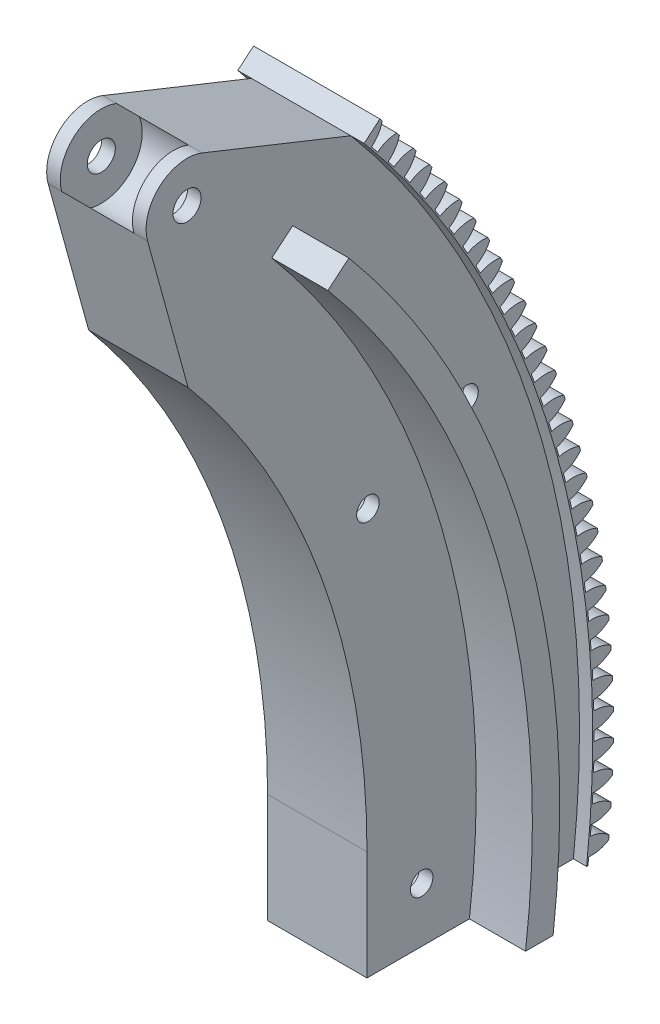
from build123d import *

# Parameters (mm, degrees)
TEETH_BLANK_DEPTH                                  = 6.35
PRIMARY_BLANK_DEPTH                                = 29.464
TOOTH_CUT_DEPTH                                    = 6.35
TOOTH_PATTERN_COUNT                                = 230
HOLES_FOR_TOP_SUPPORT_DEPTH                        = 284.05774535
HOLES_FOR_TOP_SUPPORT_DEPTH_BACK                   = 284.05774535
SKETCH15_R                                         = 3.2639
THING_TO_SLIDE_ALONG_BEARINGS_DEPTH                = 9.87425
EXTENDING_START                                    = 23.01875
EXTENDING_TEETH_DEPTH                              = 23.01875
SKETCH28_R                                         = 9.525
CUT_FOR_SPACE_FOR_TOP_SUPPORT_SCREWS_DEPTH         = 16.764
SKETCH29_R                                         = 3.429
MAGNET_HOLE_DEPTH                                  = 12.7
CUT_START                                          = -3.175
CUT_TO_MAKE_SPACE_FOR_ALUMINUM_REINFORCE_DEPTH     = 3.175
EMBEDDED_NUT_CAVITIES_DEPTH                        = 3.302
HOLES_FOR_BOLTS_FOR_REINFORCEMENT_PLATE_DEPTH      = 285.034601492
HOLES_FOR_BOLTS_FOR_REINFORCEMENT_PLATE_DEPTH_BACK = 285.034601492
SKETCH34_R                                         = 2.6289


with BuildPart() as part:
    # Sketch11 → Teeth blank (new body)
    with BuildSketch(Plane(origin=(6.35, 0, 0), x_dir=(0, 0, -1), z_dir=(1, 0, 0))):
        with BuildLine():
            Line((177.722316491, 149.126730219), (155.660230842, 130.614442288))
            ThreePointArc((155.660230842, 130.614442288), (190.945540544, 69.498493124), (203.2, 0))
            ThreePointArc((203.2, 0), (202.801171077, -12.724975829), (201.606249903, -25.4))
            Line((201.606249903, -25.4), (230.605384683, -25.4))
            ThreePointArc((230.605384683, -25.4), (231.65108936, -12.719129025), (232.000007424, 0))
            ThreePointArc((232.000007424, 0), (218.008694999, 79.348675791), (177.722316491, 149.126730219))
        make_face()
    extrude(amount=-TEETH_BLANK_DEPTH)

    # Sketch1 → Primary blank (add)
    with BuildSketch(Plane(origin=(0, 0, 0), x_dir=(0, 0, -1), z_dir=(1, 0, 0))):
        with BuildLine():
            Line((177.8, 0), (177.8, -25.4))
            Line((177.8, -25.4), (225.775729431, -25.4))
            ThreePointArc((225.775729431, -25.4), (226.843652905, -12.71995034), (227.2, 0))
            ThreePointArc((227.2, 0), (213.498163443, 77.706976564), (174.045297477, 146.041344921))
            Line((174.045297477, 146.041344921), (139.503343029, 159.851365822))
            ThreePointArc((139.503343029, 159.851365822), (129.618020291, 158.107153482), (126.784391338, 148.47738561))
            Line((126.784391338, 148.47738561), (136.202701987, 114.287637002))
            ThreePointArc((136.202701987, 114.287637002), (167.077347976, 60.811181483), (177.8, 0))
        make_face()
    extrude(amount=PRIMARY_BLANK_DEPTH)

    # Sketch12 → Tooth cut (cut)
    with BuildSketch(Plane(origin=(6.35, 0, 0), x_dir=(0, 0, -1), z_dir=(1, 0, 0))):
        with BuildLine():
            ThreePointArc((227.497230324, 1.124058456), (230.494867292, 1.773780404), (232.972473, 3.581938572))
            ThreePointArc((232.972473, 3.581938572), (233.000007424, 0), (232.972473, -3.581938572))
            ThreePointArc((232.972473, -3.581938572), (230.494867292, -1.773780404), (227.497230324, -1.124058456))
            ThreePointArc((227.497230324, -1.124058456), (227.50000728, 0), (227.497230324, 1.124058456))
        make_face()
    tooth_cut = extrude(amount=-TOOTH_CUT_DEPTH, mode=Mode.SUBTRACT)

    # Tooth pattern: Tooth cut ×230 about axis
    tooth_pattern_axis = Axis((0, 0, 0), (1, 0, 0))
    for i in range(1, TOOTH_PATTERN_COUNT):
        add(tooth_cut.rotate(tooth_pattern_axis, i * 360 / TOOTH_PATTERN_COUNT), mode=Mode.SUBTRACT)

    # Sketch15 → Holes for top support (cut, two sides: drawn at the far end of the back side and taken through both)
    with BuildSketch(Plane(origin=(6.35, 0, 0), x_dir=(0, 0, -1), z_dir=(1, 0, 0)).offset(-HOLES_FOR_TOP_SUPPORT_DEPTH_BACK)):
        with Locations((135.967339212, 151.007028537)):
            Circle(SKETCH15_R)
    extrude(amount=HOLES_FOR_TOP_SUPPORT_DEPTH + HOLES_FOR_TOP_SUPPORT_DEPTH_BACK, mode=Mode.SUBTRACT)

    # Sketch23 → Thing to slide along bearings (add)
    with BuildSketch(Plane(origin=(0, 0, 0), x_dir=(0, 0, -1), z_dir=(1, 0, 0))):
        with BuildLine():
            Line((155.660230842, 130.614442288), (160.524613056, 134.69614361))
            ThreePointArc((160.524613056, 134.69614361), (196.912588686, 71.670321034), (209.55, 0))
            ThreePointArc((209.55, 0), (209.163370775, -12.723475387), (208.004909798, -25.4))
            Line((208.004909798, -25.4), (201.606249903, -25.4))
            ThreePointArc((201.606249903, -25.4), (202.801171077, -12.724975829), (203.2, 0))
            ThreePointArc((203.2, 0), (190.945540544, 69.498493124), (155.660230842, 130.614442288))
        make_face()
    thing_to_slide_along_bearings = extrude(amount=-THING_TO_SLIDE_ALONG_BEARINGS_DEPTH)

    # Mirroring slider: Thing to slide along bearings across plane
    add(thing_to_slide_along_bearings.mirror(Plane(origin=(14.732, 0, 0), x_dir=(0, 0, 1), z_dir=(1, 0, 0))))

    # Sketch27 → Extending teeth (add)
    with BuildSketch(Plane(origin=(6.35, 0, 0), x_dir=(0, 0, -1), z_dir=(1, 0, 0)).offset(EXTENDING_START)):
        with BuildLine():
            Line((177.722316491, 149.126730219), (174.045297477, 146.041344921))
            ThreePointArc((174.045297477, 146.041344921), (217.513785946, 65.632255207), (225.775729431, -25.4))
            Line((225.775729431, -25.4), (226.07762674, -25.4))
            ThreePointArc((226.07762674, -25.4), (226.171897735, -24.546404775), (226.262945845, -23.692459772))
            ThreePointArc((226.262945845, -23.692459772), (228.663101283, -23.551544215), (230.891757831, -22.649494707))
            ThreePointArc((230.891757831, -22.649494707), (230.94034564, -22.148593645), (230.987846786, -21.647588364))
            ThreePointArc((230.987846786, -21.647588364), (228.971262049, -20.338394215), (226.641640358, -19.743864063))
            ThreePointArc((226.641640358, -19.743864063), (226.736426656, -18.623805724), (226.825677683, -17.503292725))
            ThreePointArc((226.825677683, -17.503292725), (229.221088498, -17.296869983), (231.424274191, -16.33428174))
            ThreePointArc((231.424274191, -16.33428174), (231.459161859, -15.832240407), (231.492960423, -15.330124577))
            ThreePointArc((231.492960423, -15.330124577), (229.441367736, -14.07650152), (227.096375799, -13.545826347))
            ThreePointArc((227.096375799, -13.545826347), (227.160532561, -12.423596854), (227.219143699, -11.301064066))
            ThreePointArc((227.219143699, -11.301064066), (229.608022346, -11.029288179), (231.784093084, -10.006879521))
            ThreePointArc((231.784093084, -10.006879521), (231.805254577, -9.504072559), (231.825325337, -9.001220877))
            ThreePointArc((231.825325337, -9.001220877), (229.740255675, -7.804104412), (227.381643413, -7.337680228))
            ThreePointArc((227.381643413, -7.337680228), (227.415122764, -6.21411703), (227.443050275, -5.090402129))
            ThreePointArc((227.443050275, -5.090402129), (229.823614083, -4.753475906), (231.970946001, -3.672009792))
            ThreePointArc((231.970946001, -3.672009792), (231.978365527, -3.168812415), (231.984693505, -2.665600128))
            ThreePointArc((231.984693505, -2.665600128), (229.867702826, -1.525883589), (227.497230324, -1.124058456))
            ThreePointArc((227.497230324, -1.124058456), (227.50000728, 0), (227.497230324, 1.124058456))
            ThreePointArc((227.497230324, 1.124058456), (229.867702826, 1.525883589), (231.984693505, 2.665600128))
            ThreePointArc((231.984693505, 2.665600128), (231.978365527, 3.168812415), (231.970946001, 3.672009792))
            ThreePointArc((231.970946001, 3.672009792), (229.823614083, 4.753475906), (227.443050275, 5.090402129))
            ThreePointArc((227.443050275, 5.090402129), (227.415122764, 6.21411703), (227.381643413, 7.337680228))
            ThreePointArc((227.381643413, 7.337680228), (229.740255675, 7.804104412), (231.825325337, 9.001220877))
            ThreePointArc((231.825325337, 9.001220877), (231.805254577, 9.504072559), (231.784093084, 10.006879521))
            ThreePointArc((231.784093084, 10.006879521), (229.608022346, 11.029288179), (227.219143699, 11.301064066))
            ThreePointArc((227.219143699, 11.301064066), (227.160532561, 12.423596854), (227.096375799, 13.545826347))
            ThreePointArc((227.096375799, 13.545826347), (229.441367736, 14.07650152), (231.492960423, 15.330124577))
            ThreePointArc((231.492960423, 15.330124577), (231.459161859, 15.832240407), (231.424274191, 16.33428174))
            ThreePointArc((231.424274191, 16.33428174), (229.221088498, 17.296869983), (226.825677683, 17.503292725))
            ThreePointArc((226.825677683, 17.503292725), (226.736426656, 18.623805724), (226.641640358, 19.743864063))
            ThreePointArc((226.641640358, 19.743864063), (228.971262049, 20.338394215), (230.987846786, 21.647588364))
            ThreePointArc((230.987846786, 21.647588364), (230.94034564, 22.148593645), (230.891757831, 22.649494707))
            ThreePointArc((230.891757831, 22.649494707), (228.663101283, 23.551544215), (226.262945845, 23.692459772))
            ThreePointArc((226.262945845, 23.692459772), (226.143121532, 24.810116812), (226.017776432, 25.927168167))
            ThreePointArc((226.017776432, 25.927168167), (228.330289425, 26.585109638), (230.310361361, 27.94889791))
            ThreePointArc((230.310361361, 27.94889791), (230.24919308, 28.448418771), (230.186941388, 28.947805772))
            ThreePointArc((230.186941388, 28.947805772), (227.934477093, 29.788643403), (225.531368117, 29.863946617))
            ThreePointArc((225.531368117, 29.863946617), (225.381059935, 30.977913661), (225.225249571, 32.091124447))
            ThreePointArc((225.225249571, 32.091124447), (227.518928183, 32.811986256), (229.461009714, 34.22935094))
            ThreePointArc((229.461009714, 34.22935094), (229.386219944, 34.727014622), (229.310350824, 35.2245149))
            ThreePointArc((229.310350824, 35.2245149), (227.035759654, 36.003513188), (224.631490431, 36.013147865))
            ThreePointArc((224.631490431, 36.013147865), (224.450810546, 37.12259363), (224.264651187, 38.231133128))
            ThreePointArc((224.264651187, 38.231133128), (226.537783789, 39.01437734), (228.440425662, 40.484260746))
            ThreePointArc((228.440425662, 40.484260746), (228.352070214, 40.979695873), (228.262640281, 41.474938174))
            ThreePointArc((228.262640281, 41.474938174), (225.967619622, 42.191515802), (223.563984308, 42.135474753))
            ThreePointArc((223.563984308, 42.135474753), (223.353067549, 43.239571328), (223.136698117, 44.342612304))
            ThreePointArc((223.136698117, 44.342612304), (225.387588412, 45.187654434), (227.249370803, 46.70895968))
            ThreePointArc((227.249370803, 46.70895968), (227.147515611, 47.201796539), (227.044591603, 47.694411295))
            ThreePointArc((227.044591603, 47.694411295), (224.730854085, 48.348033526), (222.329646362, 48.226358571))
            ThreePointArc((222.329646362, 48.226358571), (222.088650124, 49.324282038), (221.84223208, 50.421001361))
            ThreePointArc((221.84223208, 50.421001361), (224.06920037, 51.327210806), (225.888733947, 52.898802637))
            ThreePointArc((225.888733947, 52.898802637), (225.773455019, 53.388673455), (225.657113741, 53.878293059))
            ThreePointArc((225.657113741, 53.878293059), (223.326385962, 54.468472135), (220.929397701, 54.281254073))
            ThreePointArc((220.929397701, 54.281254073), (220.658501825, 55.37218512), (220.382219056, 56.461764377))
            ThreePointArc((220.382219056, 56.461764377), (222.583603493, 57.428464891), (224.359530453, 59.049170525))
            ThreePointArc((224.359530453, 59.049170525), (224.230913815, 59.535709743), (224.101242084, 60.021968822))
            ThreePointArc((224.101242084, 60.021968822), (221.75526332, 60.54826433), (219.364283245, 60.295642869))
            ThreePointArc((219.364283245, 60.295642869), (219.063689882, 61.378767402), (218.75774856, 62.460393508))
            ThreePointArc((218.75774856, 62.460393508), (220.931906389, 63.486863702), (222.662901469, 65.15547371))
            ThreePointArc((222.662901469, 65.15547371), (222.521043099, 65.638318252), (222.378137682, 66.120853942))
            ThreePointArc((222.378137682, 66.120853942), (220.01865859, 66.58287314), (217.635470939, 66.265036796))
            ThreePointArc((217.635470939, 66.265036796), (217.305404404, 67.339546548), (216.970032835, 68.412412353))
            ThreePointArc((216.970032835, 68.412412353), (219.115341617, 69.497886237), (220.800113083, 71.213155438))
            ThreePointArc((220.800113083, 71.213155438), (220.645118841, 71.691944989), (220.489086379, 72.170397203))
            ThreePointArc((220.489086379, 72.170397203), (218.117867692, 72.567795315), (215.744250889, 72.18498127))
            ThreePointArc((215.744250889, 72.18498127), (215.384957489, 73.250074401), (215.02040594, 74.313379293))
            ThreePointArc((215.02040594, 74.313379293), (217.135264766, 75.457046844), (218.772555378, 77.21769524))
            ThreePointArc((218.772555378, 77.21769524), (218.604540927, 77.69207251), (218.435497858, 78.166084208))
            ThreePointArc((218.435497858, 78.166084208), (216.054309067, 78.498564682), (213.692034393, 78.051058605))
            ThreePointArc((213.692034393, 78.051058605), (213.303782248, 79.105940303), (212.91032276, 80.158890803))
            ThreePointArc((212.91032276, 80.158890803), (214.993153443, 81.359898575), (216.581741393, 83.164612305))
            ThreePointArc((216.581741393, 83.164612305), (216.400832112, 83.634223294), (216.218904581, 84.103440753))
            ThreePointArc((216.218904581, 84.103440753), (213.829522619, 84.370755478), (211.480352893, 83.858891315))
            ThreePointArc((211.480352893, 83.858891315), (211.06343173, 84.902774388), (210.641357917, 85.944584746))
            ThreePointArc((210.641357917, 85.944584746), (212.690606171, 87.202036501), (214.229305997, 89.049468819))
            ThreePointArc((214.229305997, 89.049468819), (214.035636886, 89.513963087), (213.840960655, 89.978036158))
            ThreePointArc((213.840960655, 89.978036158), (211.445168568, 90.179985654), (209.110856828, 89.604145378))
            ThreePointArc((209.110856828, 89.604145378), (208.66557777, 90.63625084), (208.2152046, 91.666143618))
            ThreePointArc((208.2152046, 91.666143618), (210.229341199, 92.979100999), (211.717004663, 94.867873282))
            ThreePointArc((211.717004663, 94.867873282), (211.510720247, 95.326904206), (211.30344059, 95.78548658))
            ThreePointArc((211.30344059, 95.78548658), (208.903026208, 95.921920145), (206.585314405, 95.28253347))
            ThreePointArc((206.585314405, 95.28253347), (206.112009735, 96.302091126), (205.633673294, 97.319297778))
            ThreePointArc((205.633673294, 97.319297778), (207.611195213, 98.686781007), (209.046712167, 100.615483783))
            ThreePointArc((209.046712167, 100.615483783), (208.827966381, 101.068708817), (208.608237979, 101.521458283))
            ThreePointArc((208.608237979, 101.521458283), (206.204992582, 101.592274105), (203.905610279, 100.889818164))
            ThreePointArc((203.905610279, 100.889818164), (203.404633195, 101.896067182), (202.898690434, 102.899828632))
            ThreePointArc((202.898690434, 102.899828632), (204.838121973, 104.320817242), (206.220421179, 106.28801124))
            ThreePointArc((206.220421179, 106.28801124), (205.989377261, 106.735092169), (205.757364083, 107.181670869))
            ThreePointArc((205.757364083, 107.181670869), (203.353081061, 107.186816103), (201.073744144, 106.421815095))
            ThreePointArc((201.073744144, 106.421815095), (200.545468495, 107.414004574), (200.012296968, 108.403571777))
            ThreePointArc((200.012296968, 108.403571777), (201.91219085, 109.877005372), (203.240240785, 111.881222599))
            ThreePointArc((203.240240785, 111.881222599), (202.997071148, 112.321825796), (202.752946331, 112.761900475))
            ThreePointArc((202.752946331, 112.761900475), (200.349419851, 112.701371281), (198.091829247, 111.874396079))
            ThreePointArc((198.091829247, 111.874396079), (197.53664925, 112.851785611), (196.97664683, 113.826420114))
            ThreePointArc((196.97664683, 113.826420114), (198.835585283, 115.351199164), (200.108394907, 117.390943997))
            ThreePointArc((200.108394907, 117.390943997), (199.853281013, 117.824740666), (199.597226732, 118.257982925))
            ThreePointArc((199.597226732, 118.257982925), (197.196250396, 118.131824473), (194.962090802, 117.243492197))
            ThreePointArc((194.962090802, 117.243492197), (194.380420754, 118.205352416), (193.794005336, 119.164326911))
            ThreePointArc((193.794005336, 119.164326911), (195.610601151, 120.739313568), (196.827220645, 122.813063873))
            ThreePointArc((196.827220645, 122.813063873), (196.56035287, 123.2397303), (196.292560202, 123.665816837))
            ThreePointArc((196.292560202, 123.665816837), (193.895925708, 123.47412327), (191.686864339, 122.525096826))
            ThreePointArc((191.686864339, 122.525096826), (191.079138305, 123.470709957), (190.466747493, 124.413308821))
            ThreePointArc((190.466747493, 124.413308821), (192.239645057, 126.037327771), (193.399166535, 128.143536038))
            ThreePointArc((193.399166535, 128.143536038), (193.120744025, 128.562753829), (192.841412808, 128.981366682))
            ThreePointArc((192.841412808, 128.981366682), (190.450908614, 128.724281049), (188.268593954, 127.715268637))
            ThreePointArc((188.268593954, 127.715268637), (187.635265441, 128.643929027), (186.997356225, 129.569448858))
            ThreePointArc((186.997356225, 129.569448858), (188.725232536, 131.241288196), (189.826790719, 133.378382695))
            ThreePointArc((189.826790719, 133.378382695), (189.537021244, 133.789839012), (189.246359924, 134.200665797))
            ThreePointArc((189.246359924, 134.200665797), (186.863769915, 133.878379945), (184.709830489, 132.810134528))
            ThreePointArc((184.709830489, 132.810134528), (184.05137211, 133.721149176), (183.388420522, 134.628899316))
            ThreePointArc((183.388420522, 134.628899316), (185.069986174, 136.347311455), (186.112759037, 138.513697403))
            ThreePointArc((186.112759037, 138.513697403), (185.811858834, 138.917085204), (185.510084314, 139.319819345))
            ThreePointArc((185.510084314, 139.319819345), (183.137186467, 138.932573777), (181.013229625, 137.805892519))
            ThreePointArc((181.013229625, 137.805892519), (180.330132748, 138.698581592), (179.642633506, 139.587884644))
            ThreePointArc((179.642633506, 139.587884644), (181.276633653, 141.351587239), (182.25984304, 143.545648))
            ThreePointArc((182.25984304, 143.545648), (181.948036652, 143.94066626), (181.635374127, 144.335007224))
            ThreePointArc((181.635374127, 144.335007224), (179.273939188, 143.883090915), (177.181549907, 142.698814589))
            ThreePointArc((177.181549907, 142.698814589), (176.474324282, 143.572511928), (175.762790426, 144.442704261))
            ThreePointArc((175.762790426, 144.442704261), (177.348005713, 146.250381172), (178.270917918, 148.470479455))
            ThreePointArc((178.270917918, 148.470479455), (177.996919643, 148.798857665), (177.722316491, 149.126730219))
        make_face()
    extrude(amount=-EXTENDING_TEETH_DEPTH)

    # Sketch28 → Cut for space for top support screws (cut)
    with BuildSketch(Plane(origin=(6.35, 0, 0), x_dir=(0, 0, -1), z_dir=(1, 0, 0))):
        with Locations((135.967339212, 151.007028537)):
            Circle(SKETCH28_R)
    extrude(amount=CUT_FOR_SPACE_FOR_TOP_SUPPORT_SCREWS_DEPTH, mode=Mode.SUBTRACT)

    # Sketch29 → Magnet hole (cut)
    with BuildSketch(Plane.XZ.offset(25.4)):
        with Locations((14.7081875, -201.93881337)):
            Circle(SKETCH29_R)
    extrude(amount=-MAGNET_HOLE_DEPTH, mode=Mode.SUBTRACT)

    # Sketch30 → Cut to make space for aluminum reinforcement plate (cut)
    with BuildSketch(Plane(origin=(29.464, 0, 0), x_dir=(0, 0, -1), z_dir=(1, 0, 0)).offset(CUT_START)):
        with BuildLine():
            Line((155.660230842, 130.614442288), (160.524613056, 134.69614361))
            ThreePointArc((160.524613056, 134.69614361), (200.900960932, 59.581930119), (208.004909798, -25.4))
            Line((208.004909798, -25.4), (225.775729431, -25.4))
            ThreePointArc((225.775729431, -25.4), (217.513785946, 65.632255207), (174.045297477, 146.041344921))
            Line((174.045297477, 146.041344921), (139.503343029, 159.851365822))
            ThreePointArc((139.503343029, 159.851365822), (129.618020291, 158.107153482), (126.784391338, 148.47738561))
            Line((126.784391338, 148.47738561), (136.202701987, 114.287637002))
            ThreePointArc((136.202701987, 114.287637002), (167.077347976, 60.811181483), (177.8, 0))
            Line((177.8, 0), (177.8, -25.4))
            Line((177.8, -25.4), (201.606249903, -25.4))
            ThreePointArc((201.606249903, -25.4), (194.922962004, 57.404519712), (155.660230842, 130.614442288))
        make_face()
    cut_to_make_space_for_aluminum_reinforce = extrude(amount=CUT_TO_MAKE_SPACE_FOR_ALUMINUM_REINFORCE_DEPTH, mode=Mode.SUBTRACT)

    # Mirroring the above cut: Cut to make space for aluminum reinforcement plate across plane
    add(cut_to_make_space_for_aluminum_reinforce.mirror(Plane(origin=(14.732, 0, 0), x_dir=(0, 0, 1), z_dir=(1, 0, 0))), mode=Mode.SUBTRACT)

    # Sketch31 → Embedded nut cavities (cut)
    with BuildSketch(Plane(origin=(23.114, 0, 0), x_dir=(0, 0, -1), z_dir=(1, 0, 0))):
        Polygon((190.5, -18.345908282), (195.3895, -15.522954141), (195.3895, -9.877045859), (190.5, -7.054091718), (185.6105, -9.877045859), (185.6105, -15.522954141), align=None)
        Polygon((211.0105, -15.522954141), (215.9, -18.345908282), (220.7895, -15.522954141), (220.7895, -9.877045859), (215.9, -7.054091718), (211.0105, -9.877045859), align=None)
        Polygon((180.404949299, 63.881739325), (183.643309251, 68.506596636), (181.257245307, 73.623527278), (175.63282141, 74.115600607), (172.394461458, 69.490743296), (174.780525402, 64.373812655), align=None)
        Polygon((197.800743193, 75.108316503), (203.42516709, 74.616243173), (206.663527042, 79.241100485), (204.277463098, 84.358031126), (198.653039201, 84.850104456), (195.414679248, 80.225247144), align=None)
    embedded_nut_cavities = extrude(amount=-EMBEDDED_NUT_CAVITIES_DEPTH, mode=Mode.SUBTRACT)

    # Sketch34 → Holes for bolts for reinforcement plate mounting (cut, two sides: drawn at the far end of the back side and taken through both)
    with BuildSketch(Plane(origin=(23.114, 0, 0), x_dir=(0, 0, -1), z_dir=(1, 0, 0)).offset(-HOLES_FOR_BOLTS_FOR_REINFORCEMENT_PLATE_DEPTH_BACK)):
        with Locations((190.5, -12.7)):
            Circle(SKETCH34_R)
        with Locations((215.9, -12.7)):
            Circle(SKETCH34_R)
        with Locations((178.018885355, 68.998669966)):
            Circle(SKETCH34_R)
        with Locations((201.039103145, 79.733173814)):
            Circle(SKETCH34_R)
    extrude(amount=HOLES_FOR_BOLTS_FOR_REINFORCEMENT_PLATE_DEPTH + HOLES_FOR_BOLTS_FOR_REINFORCEMENT_PLATE_DEPTH_BACK, mode=Mode.SUBTRACT)

    # More embedded nut cavities: Embedded nut cavities across plane
    add(embedded_nut_cavities.mirror(Plane(origin=(14.732, 0, 0), x_dir=(0, 0, 1), z_dir=(1, 0, 0))), mode=Mode.SUBTRACT)


solid = part.part
